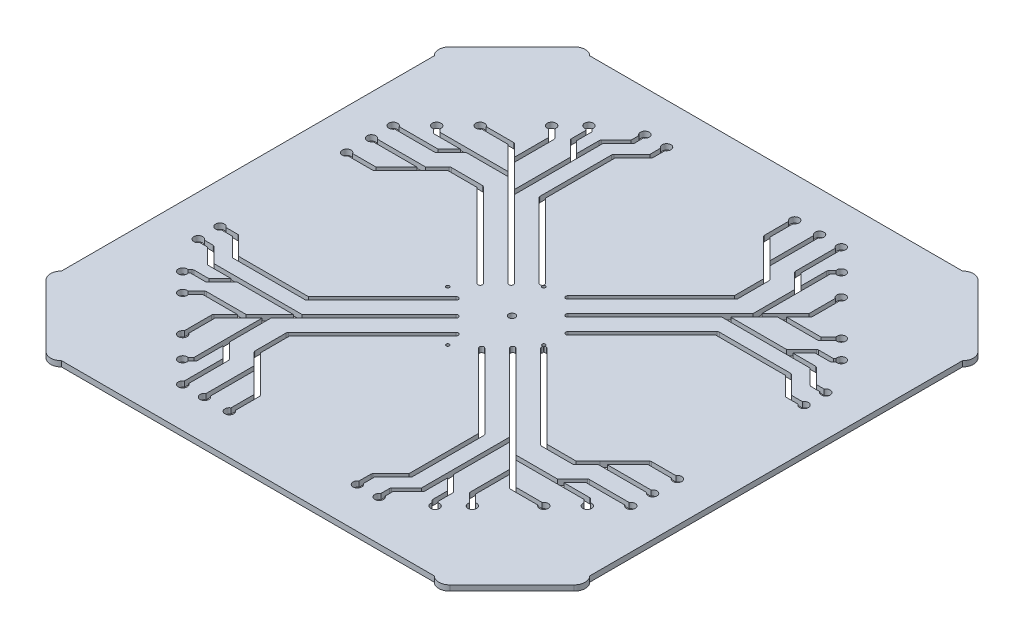
from build123d import *

# Parameters (mm, degrees)
BOSS_EXTRUDE1_OUTLINE_R   = 3.0005
BOSS_EXTRUDE1_DEPTH       = 5
F_3_0MM_DOWEL_HOLE1_D     = 3
F_3_0MM_DOWEL_HOLE1_DEPTH = 23
F_3_0MM_DOWEL_HOLE1_TIP   = 0.901290929


# Read off the part's stored shape, not the designer's step: Boss-Extrude1
with BuildPart() as part:
    # Boss-Extrude1 outline → Boss-Extrude1 (new body)
    with BuildSketch(Plane(origin=(0, 0, 0), x_dir=(1, 0, 0), z_dir=(0, 1, 0))):
        with BuildLine():
            ThreePointArc((-240.416840957, -169.705683688), (-243.345680368, -176.777104075), (-240.416663372, -183.848450908))
            ThreePointArc((-240.416663372, -183.848450908), (-240.416545273, -183.84763361), (-240.415777249, -183.847937028))
            Line((-240.415777249, -183.847937028), (-183.847440958, -240.41627332))
            ThreePointArc((-183.847440958, -240.41627332), (-176.776668104, -243.344933138), (-169.705934893, -240.416177611))
            ThreePointArc((-169.705934893, -240.416177611), (-169.705776232, -240.416065882), (-169.705584901, -240.416028356))
            Line((-169.705584901, -240.416028356), (169.705715099, -240.416028357))
            ThreePointArc((169.705715099, -240.416028357), (169.705904517, -240.41606656), (169.70606509, -240.416174054))
            ThreePointArc((169.70606509, -240.416174054), (176.776796895, -243.344832258), (183.847511548, -240.416127618))
            Line((183.847511548, -240.416127618), (240.41607294, -183.847689011))
            ThreePointArc((240.41607294, -183.847689011), (243.344946822, -176.777070236), (240.416493559, -169.706277241))
            ThreePointArc((240.416493559, -169.706277241), (240.416198695, -169.706232068), (240.415994505, -169.706014601))
            ThreePointArc((240.415994505, -169.706014601), (240.415625207, -169.705529599), (240.415954506, -169.705016598))
            Line((240.415954506, -169.705016598), (240.415960006, 169.705472419))
            ThreePointArc((240.415960006, 169.705472419), (240.415993998, 169.705647897), (240.416093049, 169.705796681))
            ThreePointArc((240.416093049, 169.705796681), (243.344777242, 176.776521251), (240.416088713, 183.847246292))
            Line((240.416088713, 183.847246292), (213.552385977, 210.712299185))
            Line((213.552385977, 210.712299185), (183.848254125, 240.41651169))
            ThreePointArc((183.848254125, 240.41651169), (176.77708352, 243.344924484), (169.706152209, 240.415933939))
            ThreePointArc((169.706152209, 240.415933939), (169.705982159, 240.415634754), (169.705659043, 240.415516325))
            Line((169.705659043, 240.415516325), (-169.705640957, 240.415516325))
            ThreePointArc((-169.705640957, 240.415516325), (-169.705953336, 240.415625916), (-169.706128779, 240.415906648))
            ThreePointArc((-169.706128779, 240.415906648), (-176.77682132, 243.344422742), (-183.847437503, 240.415722292))
            Line((-183.847437503, 240.415722292), (-240.415945248, 183.847114547))
            ThreePointArc((-240.415945248, 183.847114547), (-243.344629178, 176.776449895), (-240.415995236, 169.705764538))
            ThreePointArc((-240.415995236, 169.705764538), (-240.41588385, 169.705606698), (-240.415845984, 169.705416325))
            Line((-240.415845984, 169.705416325), (-240.415840957, -169.705883675))
            ThreePointArc((-240.415840957, -169.705883675), (-240.416340957, -169.706383675), (-240.416840957, -169.705683688))
        make_face()
        with BuildLine():
            Line((-88.746659877, -114.870657252), (-12.379109877, -38.503107252))
            ThreePointArc((-12.379109877, -38.503107252), (-9.550659876, -38.503107251), (-9.550659876, -41.331557252))
            Line((-9.550659876, -41.331557252), (-85.332453159, -117.113350535))
            Line((-85.332453159, -117.113350535), (-85.332453159, -143.740614765))
            Line((-85.332453159, -143.740614765), (-74.604410722, -154.46856238))
            Line((-74.604410722, -154.46856238), (-51.977042487, -177.096033675))
            ThreePointArc((-51.977042487, -177.096033675), (-51.543485814, -177.74489709), (-51.391240957, -178.510283675))
            Line((-51.391240957, -178.510283675), (-51.391240957, -200.50198206))
            ThreePointArc((-51.391240957, -200.50198206), (-53.391240957, -207.966083675), (-55.391240957, -200.50198206))
            Line((-55.391240957, -200.50198206), (-55.391240957, -179.338832538))
            Line((-55.391240957, -179.338832538), (-74.018740957, -160.711247695))
            Line((-74.018740957, -160.711247695), (-74.018740957, -200.50198206))
            ThreePointArc((-74.018740957, -200.50198206), (-76.018740957, -207.966083675), (-78.018740957, -200.50198206))
            Line((-78.018740957, -200.50198206), (-78.018740957, -156.711232303))
            Line((-78.018740957, -156.711232303), (-88.74666653, -145.983309632))
            ThreePointArc((-88.74666653, -145.983309632), (-89.180212173, -145.334462868), (-89.332453159, -144.569095878))
            Line((-89.332453159, -144.569095878), (-89.332453159, -116.291342276))
            ThreePointArc((-89.332453159, -116.291342276), (-89.181449298, -115.522492892), (-88.746659877, -114.870657252))
        make_face(mode=Mode.SUBTRACT)
        with BuildLine():
            Line((-107.959794229, -77.515273003), (-40.663366193, -10.218850935))
            ThreePointArc((-40.663366193, -10.218850935), (-37.834916193, -10.21885106), (-37.834916318, -13.047301061))
            Line((-37.834916318, -13.047301061), (-105.717194298, -80.929567004))
            ThreePointArc((-105.717194298, -80.929567004), (-106.373986935, -81.366384948), (-107.148593708, -81.515283676))
            Line((-107.148593708, -81.515283676), (-172.185240957, -81.515283676))
            ThreePointArc((-172.185240957, -81.515283676), (-172.950607738, -81.363042775), (-173.599454392, -80.929497366))
            Line((-173.599454392, -80.929497366), (-189.984281709, -64.544673003))
            Line((-189.984281709, -64.544673003), (-199.833828669, -64.544673003))
            ThreePointArc((-199.833828669, -64.544673003), (-207.297930284, -62.544673003), (-199.833828669, -60.544673003))
            Line((-199.833828669, -60.544673003), (-189.155730284, -60.544673003))
            ThreePointArc((-189.155730284, -60.544673003), (-188.390343699, -60.69691786), (-187.741480284, -61.130474533))
            Line((-187.741480284, -61.130474533), (-171.356778363, -77.515273003))
            Line((-171.356778363, -77.515273003), (-107.959794229, -77.515273003))
        make_face(mode=Mode.SUBTRACT)
        with BuildLine():
            Line((-96.646054519, -94.485870113), (-26.521234877, -24.361050471))
            ThreePointArc((-26.521234877, -24.361050471), (-23.692853096, -24.361050471), (-23.692853096, -27.189432252))
            Line((-23.692853096, -27.189432252), (-107.959865234, -111.456444391))
            Line((-107.959865234, -111.456444391), (-107.959865234, -149.397628131))
            Line((-107.959865234, -149.397628131), (-94.403495957, -162.953901551))
            ThreePointArc((-94.403495957, -162.953901551), (-93.969946807, -163.602749982), (-93.817704519, -164.368120113))
            Line((-93.817704519, -164.368120113), (-93.817704519, -200.502018498))
            ThreePointArc((-93.817704519, -200.502018498), (-95.817704519, -207.966120113), (-97.817704519, -200.502018498))
            Line((-97.817704519, -200.502018498), (-97.817704519, -165.196545437))
            Line((-97.817704519, -165.196545437), (-107.959865234, -155.054450658))
            Line((-107.959865234, -155.054450658), (-107.959865234, -178.510310674))
            ThreePointArc((-107.959865234, -178.510310674), (-108.113869082, -179.279919798), (-108.552163438, -179.931006156))
            Line((-108.552163438, -179.931006156), (-111.752943384, -183.131786102))
            ThreePointArc((-111.752943384, -183.131786102), (-118.445039213, -186.995539669), (-114.581422253, -180.30336497))
            Line((-114.581422253, -180.30336497), (-111.959840957, -177.681783674))
            Line((-111.959840957, -177.681783674), (-111.959840957, -115.456397087))
            Line((-111.959840957, -115.456397087), (-133.415640957, -136.912281374))
            Line((-133.415640957, -136.912281374), (-133.415640957, -160.90398206))
            ThreePointArc((-133.415640957, -160.90398206), (-135.415640957, -168.368083675), (-137.415640957, -160.90398206))
            Line((-137.415640957, -160.90398206), (-137.415640957, -136.083883676))
            ThreePointArc((-137.415640957, -136.083883676), (-137.263400022, -135.318516811), (-136.829854519, -134.669670113))
            Line((-136.829854519, -134.669670113), (-126.101904519, -123.941720113))
            Line((-126.101904519, -123.941720113), (-157.21460762, -123.941720113))
            Line((-157.21460762, -123.941720113), (-164.078807601, -130.805920094))
            ThreePointArc((-164.078807601, -130.805920094), (-170.770900984, -134.669677897), (-166.90728826, -127.977500753))
            Line((-166.90728826, -127.977500753), (-159.463134739, -120.533347231))
            ThreePointArc((-159.463134739, -120.533347231), (-158.812277528, -120.095542201), (-158.043104519, -119.941720113))
            Line((-158.043104519, -119.941720113), (-122.101904519, -119.941720113))
            Line((-122.101904519, -119.941720113), (-100.646054519, -98.485870113))
            Line((-100.646054519, -98.485870113), (-151.557760723, -98.485870113))
            Line((-151.557760723, -98.485870113), (-165.114107621, -112.042217011))
            ThreePointArc((-165.114107621, -112.042217011), (-165.782311764, -112.429011115), (-166.528301488, -112.628023144))
            Line((-166.528301488, -112.628023144), (-179.84208768, -112.628023144))
            Line((-179.84208768, -112.628023144), (-181.049394983, -113.835358904))
            ThreePointArc((-181.049394983, -113.835358904), (-187.741540813, -117.699038068), (-183.877803915, -111.006925571))
            Line((-183.877803915, -111.006925571), (-182.090895033, -109.220016689))
            ThreePointArc((-182.090895033, -109.220016689), (-181.439912656, -108.781944474), (-180.670501488, -108.628023144))
            Line((-180.670501488, -108.628023144), (-167.356703825, -108.628023144))
            Line((-167.356703825, -108.628023144), (-157.214704737, -98.485870113))
            Line((-157.214704737, -98.485870113), (-177.842057621, -98.485870113))
            ThreePointArc((-177.842057621, -98.485870113), (-178.607424486, -98.333629178), (-179.256271183, -97.900083675))
            Line((-179.256271183, -97.900083675), (-192.812652721, -84.343702138))
            Line((-192.812652721, -84.343702138), (-199.833751105, -84.343702138))
            ThreePointArc((-199.833751105, -84.343702138), (-207.297893572, -82.343824698), (-199.833802904, -80.343753938))
            Line((-199.833802904, -80.343753938), (-191.984204519, -80.343753938))
            ThreePointArc((-191.984204519, -80.343753938), (-191.218831464, -80.495996104), (-190.569979519, -80.929545113))
            Line((-190.569979519, -80.929545113), (-177.013654519, -94.485870113))
            Line((-177.013654519, -94.485870113), (-96.646054519, -94.485870113))
        make_face(mode=Mode.SUBTRACT)
        with BuildLine():
            Line((77.529248371, -107.944536948), (10.232826303, -40.648108911))
            ThreePointArc((10.232826303, -40.648108911), (10.232826429, -37.819658911), (13.061276429, -37.819659036))
            Line((13.061276429, -37.819659036), (80.943542372, -105.701937017))
            ThreePointArc((80.943542372, -105.701937017), (81.380360316, -106.358729654), (81.529259044, -107.133336427))
            Line((81.529259044, -107.133336427), (81.529259044, -172.169983676))
            ThreePointArc((81.529259044, -172.169983676), (81.377018143, -172.935350457), (80.943472733, -173.584197111))
            Line((80.943472733, -173.584197111), (64.558648371, -189.969024428))
            Line((64.558648371, -189.969024428), (64.558648371, -199.818571388))
            ThreePointArc((64.558648371, -199.818571388), (62.558648371, -207.282673003), (60.558648371, -199.818571388))
            Line((60.558648371, -199.818571388), (60.558648371, -189.140473003))
            ThreePointArc((60.558648371, -189.140473003), (60.710893228, -188.375086418), (61.144449901, -187.726223003))
            Line((61.144449901, -187.726223003), (77.529248371, -171.341521082))
            Line((77.529248371, -171.341521082), (77.529248371, -107.944536948))
        make_face(mode=Mode.SUBTRACT)
        with BuildLine():
            Line((94.499845481, -96.630797238), (24.375025839, -26.505977595))
            ThreePointArc((24.375025839, -26.505977595), (24.375025839, -23.677595814), (27.20340762, -23.677595814))
            Line((27.20340762, -23.677595814), (111.470419759, -107.944607953))
            Line((111.470419759, -107.944607953), (149.411603499, -107.944607953))
            Line((149.411603499, -107.944607953), (162.967876918, -94.388238675))
            ThreePointArc((162.967876918, -94.388238675), (163.61672535, -93.954689526), (164.382095481, -93.802447238))
            Line((164.382095481, -93.802447238), (200.515993866, -93.802447238))
            ThreePointArc((200.515993866, -93.802447238), (207.980095481, -95.802447238), (200.515993866, -97.802447238))
            Line((200.515993866, -97.802447238), (165.210520805, -97.802447238))
            Line((165.210520805, -97.802447238), (155.068426025, -107.944607953))
            Line((155.068426025, -107.944607953), (178.524286042, -107.944607953))
            ThreePointArc((178.524286042, -107.944607953), (179.293895159, -108.098611797), (179.944981513, -108.536906145))
            Line((179.944981513, -108.536906145), (183.14576147, -111.737686103))
            ThreePointArc((183.14576147, -111.737686103), (187.009515035, -118.429781933), (180.317340338, -114.566164971))
            Line((180.317340338, -114.566164971), (177.695759042, -111.944583676))
            Line((177.695759042, -111.944583676), (115.470372455, -111.944583676))
            Line((115.470372455, -111.944583676), (136.926256742, -133.400383676))
            Line((136.926256742, -133.400383676), (160.917957428, -133.400383676))
            ThreePointArc((160.917957428, -133.400383676), (168.382059043, -135.400383675), (160.917957428, -137.400383675))
            Line((160.917957428, -137.400383675), (136.097859044, -137.400383675))
            ThreePointArc((136.097859044, -137.400383675), (135.332492179, -137.24814274), (134.683645481, -136.814597237))
            Line((134.683645481, -136.814597237), (123.955695481, -126.086647238))
            Line((123.955695481, -126.086647238), (123.955695481, -157.199350339))
            Line((123.955695481, -157.199350339), (130.819895462, -164.06355032))
            ThreePointArc((130.819895462, -164.06355032), (134.683653264, -170.755643704), (127.99147612, -166.892030979))
            Line((127.99147612, -166.892030979), (120.547322613, -159.447877471))
            ThreePointArc((120.547322613, -159.447877471), (120.109517573, -158.797020256), (119.955695481, -158.027847238))
            Line((119.955695481, -158.027847238), (119.955695481, -122.086647238))
            Line((119.955695481, -122.086647238), (98.499845481, -100.630797238))
            Line((98.499845481, -100.630797238), (98.499845481, -151.542503442))
            Line((98.499845481, -151.542503442), (112.056192379, -165.09885034))
            ThreePointArc((112.056192379, -165.09885034), (112.442986483, -165.767054483), (112.641998512, -166.513044207))
            Line((112.641998512, -166.513044207), (112.641998512, -179.826830399))
            Line((112.641998512, -179.826830399), (113.849334272, -181.034137702))
            ThreePointArc((113.849334272, -181.034137702), (117.713013436, -187.726283532), (111.020900939, -183.862546634))
            Line((111.020900939, -183.862546634), (109.233992057, -182.075637751))
            ThreePointArc((109.233992057, -182.075637751), (108.795919842, -181.424655374), (108.641998512, -180.655244207))
            Line((108.641998512, -180.655244207), (108.641998512, -167.341446544))
            Line((108.641998512, -167.341446544), (98.499845481, -157.199447455))
            Line((98.499845481, -157.199447455), (98.499845481, -177.82680034))
            ThreePointArc((98.499845481, -177.82680034), (98.347604546, -178.592167205), (97.914059043, -179.241013902))
            Line((97.914059043, -179.241013902), (84.357677506, -192.797395439))
            Line((84.357677506, -192.797395439), (84.357677506, -199.818493823))
            ThreePointArc((84.357677506, -199.818493823), (82.357800068, -207.282636291), (80.357729306, -199.818545623))
            Line((80.357729306, -199.818545623), (80.357729306, -191.968947238))
            ThreePointArc((80.357729306, -191.968947238), (80.509971472, -191.203574183), (80.943520481, -190.554722238))
            Line((80.943520481, -190.554722238), (94.499845481, -176.998397238))
            Line((94.499845481, -176.998397238), (94.499845481, -96.630797238))
        make_face(mode=Mode.SUBTRACT)
        with Locations((-4.0957e-05, -0.000283675)):
            Circle(BOSS_EXTRUDE1_OUTLINE_R, mode=Mode.SUBTRACT)
        with BuildLine():
            Line((114.88463262, -88.731402595), (38.51708262, -12.363852595))
            ThreePointArc((38.51708262, -12.363852595), (38.51708262, -9.535402595), (41.34553262, -9.535402595))
            Line((41.34553262, -9.535402595), (117.127325903, -85.317195878))
            Line((117.127325903, -85.317195878), (143.754590133, -85.317195878))
            Line((143.754590133, -85.317195878), (154.482537748, -74.589153441))
            Line((154.482537748, -74.589153441), (177.110009043, -51.961785206))
            ThreePointArc((177.110009043, -51.961785206), (177.758872459, -51.528228533), (178.524259043, -51.375983675))
            Line((178.524259043, -51.375983675), (200.515957428, -51.375983675))
            ThreePointArc((200.515957428, -51.375983675), (207.980059043, -53.375983675), (200.515957428, -55.375983675))
            Line((200.515957428, -55.375983675), (179.352807906, -55.375983675))
            Line((179.352807906, -55.375983675), (160.725223063, -74.003483675))
            Line((160.725223063, -74.003483675), (200.515957428, -74.003483675))
            ThreePointArc((200.515957428, -74.003483675), (207.980059043, -76.003483675), (200.515957428, -78.003483675))
            Line((200.515957428, -78.003483675), (156.725207671, -78.003483675))
            Line((156.725207671, -78.003483675), (145.997285, -88.731409249))
            ThreePointArc((145.997285, -88.731409249), (145.348438236, -89.164954891), (144.583071246, -89.317195878))
            Line((144.583071246, -89.317195878), (116.305317645, -89.317195878))
            ThreePointArc((116.305317645, -89.317195878), (115.53646826, -89.166192017), (114.88463262, -88.731402595))
        make_face(mode=Mode.SUBTRACT)
        with BuildLine():
            Line((-114.885914533, 88.760635244), (-38.518364533, 12.393085244))
            ThreePointArc((-38.518364533, 12.393085244), (-38.518364534, 9.564635243), (-41.346814534, 9.564635244))
            Line((-41.346814534, 9.564635244), (-117.128607817, 85.346428527))
            Line((-117.128607817, 85.346428527), (-143.755872047, 85.346428527))
            Line((-143.755872047, 85.346428527), (-154.483819661, 74.61838609))
            Line((-154.483819661, 74.61838609), (-177.111290957, 51.991017855))
            ThreePointArc((-177.111290957, 51.991017855), (-177.760154372, 51.557461182), (-178.525540957, 51.405216325))
            Line((-178.525540957, 51.405216325), (-200.517239342, 51.405216325))
            ThreePointArc((-200.517239342, 51.405216325), (-207.981340957, 53.405216325), (-200.517239342, 55.405216325))
            Line((-200.517239342, 55.405216325), (-179.35408982, 55.405216325))
            Line((-179.35408982, 55.405216325), (-160.726504976, 74.032716325))
            Line((-160.726504976, 74.032716325), (-200.517239342, 74.032716325))
            ThreePointArc((-200.517239342, 74.032716325), (-207.981340957, 76.032716325), (-200.517239342, 78.032716325))
            Line((-200.517239342, 78.032716325), (-156.726489584, 78.032716325))
            Line((-156.726489584, 78.032716325), (-145.998566913, 88.760641898))
            ThreePointArc((-145.998566913, 88.760641898), (-145.349720149, 89.19418754), (-144.584353159, 89.346428527))
            Line((-144.584353159, 89.346428527), (-116.306599558, 89.346428527))
            ThreePointArc((-116.306599558, 89.346428527), (-115.537750173, 89.195424666), (-114.885914533, 88.760635244))
        make_face(mode=Mode.SUBTRACT)
        with BuildLine():
            Line((-94.501127394, 96.660029887), (-24.376307752, 26.535210245))
            ThreePointArc((-24.376307752, 26.535210245), (-24.376307752, 23.706828464), (-27.204689533, 23.706828464))
            Line((-27.204689533, 23.706828464), (-111.471701672, 107.973840603))
            Line((-111.471701672, 107.973840603), (-149.412885412, 107.973840603))
            Line((-149.412885412, 107.973840603), (-162.969158832, 94.417471325))
            ThreePointArc((-162.969158832, 94.417471325), (-163.618007263, 93.983922175), (-164.383377394, 93.831679887))
            Line((-164.383377394, 93.831679887), (-200.517275779, 93.831679887))
            ThreePointArc((-200.517275779, 93.831679887), (-207.981377394, 95.831679887), (-200.517275779, 97.831679887))
            Line((-200.517275779, 97.831679887), (-165.211802718, 97.831679887))
            Line((-165.211802718, 97.831679887), (-155.069707939, 107.973840603))
            Line((-155.069707939, 107.973840603), (-178.525567955, 107.973840603))
            ThreePointArc((-178.525567955, 107.973840603), (-179.295177052, 108.127844438), (-179.946263396, 108.566138765))
            Line((-179.946263396, 108.566138765), (-183.147043384, 111.766918752))
            ThreePointArc((-183.147043384, 111.766918752), (-187.010796948, 118.459014583), (-180.318622251, 114.59539762))
            Line((-180.318622251, 114.59539762), (-177.697040956, 111.973816325))
            Line((-177.697040956, 111.973816325), (-115.471654369, 111.973816325))
            Line((-115.471654369, 111.973816325), (-136.927538655, 133.429616325))
            Line((-136.927538655, 133.429616325), (-160.919239341, 133.429616325))
            ThreePointArc((-160.919239341, 133.429616325), (-168.383340957, 135.429616323), (-160.919239342, 137.429616325))
            Line((-160.919239342, 137.429616325), (-136.099140957, 137.429616325))
            ThreePointArc((-136.099140957, 137.429616325), (-135.333774092, 137.27737539), (-134.684927394, 136.843829887))
            Line((-134.684927394, 136.843829887), (-123.956977394, 126.115879887))
            Line((-123.956977394, 126.115879887), (-123.956977394, 157.228582988))
            Line((-123.956977394, 157.228582988), (-130.821177376, 164.092782969))
            ThreePointArc((-130.821177376, 164.092782969), (-134.684935177, 170.784876353), (-127.992758034, 166.921263628))
            Line((-127.992758034, 166.921263628), (-120.548604488, 159.477110082))
            ThreePointArc((-120.548604488, 159.477110082), (-120.110799476, 158.82625288), (-119.956977394, 158.057079887))
            Line((-119.956977394, 158.057079887), (-119.956977394, 122.115879887))
            Line((-119.956977394, 122.115879887), (-98.501127394, 100.660029887))
            Line((-98.501127394, 100.660029887), (-98.501127394, 151.571736091))
            Line((-98.501127394, 151.571736091), (-112.057474292, 165.128082989))
            ThreePointArc((-112.057474292, 165.128082989), (-112.444268396, 165.796287132), (-112.643280426, 166.542276856))
            Line((-112.643280426, 166.542276856), (-112.643280426, 179.856063048))
            Line((-112.643280426, 179.856063048), (-113.850616185, 181.063370351))
            ThreePointArc((-113.850616185, 181.063370351), (-117.714295351, 187.75551618), (-111.022182853, 183.891779283))
            Line((-111.022182853, 183.891779283), (-109.23527397, 182.104870401))
            ThreePointArc((-109.23527397, 182.104870401), (-108.797201756, 181.453888023), (-108.643280426, 180.684476856))
            Line((-108.643280426, 180.684476856), (-108.643280426, 167.370679193))
            Line((-108.643280426, 167.370679193), (-98.501127394, 157.228680105))
            Line((-98.501127394, 157.228680105), (-98.501127394, 177.856032989))
            ThreePointArc((-98.501127394, 177.856032989), (-98.348886459, 178.621399853), (-97.915340957, 179.270246551))
            Line((-97.915340957, 179.270246551), (-84.358959419, 192.826628089))
            Line((-84.358959419, 192.826628089), (-84.358959419, 199.847726473))
            ThreePointArc((-84.358959419, 199.847726473), (-82.359081979, 207.31186894), (-80.359011219, 199.847778272))
            Line((-80.359011219, 199.847778272), (-80.359011219, 191.998179887))
            ThreePointArc((-80.359011219, 191.998179887), (-80.511253385, 191.232806832), (-80.944802394, 190.583954887))
            Line((-80.944802394, 190.583954887), (-94.501127394, 177.027629887))
            Line((-94.501127394, 177.027629887), (-94.501127394, 96.660029887))
        make_face(mode=Mode.SUBTRACT)
        with BuildLine():
            Line((-77.530530284, 107.973769597), (-10.234108217, 40.677341561))
            ThreePointArc((-10.234108217, 40.677341561), (-10.234108342, 37.84889156), (-13.062558343, 37.848891686))
            Line((-13.062558343, 37.848891686), (-80.944824285, 105.731169666))
            ThreePointArc((-80.944824285, 105.731169666), (-81.381642229, 106.387962303), (-81.530540957, 107.162569077))
            Line((-81.530540957, 107.162569077), (-81.530540957, 172.199216325))
            ThreePointArc((-81.530540957, 172.199216325), (-81.378300057, 172.964583107), (-80.944754647, 173.61342976))
            Line((-80.944754647, 173.61342976), (-64.559930285, 189.998257077))
            Line((-64.559930285, 189.998257077), (-64.559930285, 199.847804037))
            ThreePointArc((-64.559930285, 199.847804037), (-62.559930284, 207.311905652), (-60.559930284, 199.847804037))
            Line((-60.559930284, 199.847804037), (-60.559930284, 189.169705652))
            ThreePointArc((-60.559930284, 189.169705652), (-60.712175142, 188.404319067), (-61.145731815, 187.755455652))
            Line((-61.145731815, 187.755455652), (-77.530530284, 171.370753731))
            Line((-77.530530284, 171.370753731), (-77.530530284, 107.973769597))
        make_face(mode=Mode.SUBTRACT)
        with BuildLine():
            Line((96.644772606, 94.515102762), (26.519952963, 24.39028312))
            ThreePointArc((26.519952963, 24.39028312), (23.691571182, 24.39028312), (23.691571182, 27.218664901))
            Line((23.691571182, 27.218664901), (107.958583321, 111.48567704))
            Line((107.958583321, 111.48567704), (107.958583321, 149.42686078))
            Line((107.958583321, 149.42686078), (94.402214043, 162.9831342))
            ThreePointArc((94.402214043, 162.9831342), (93.968664894, 163.631982631), (93.816422606, 164.397352762))
            Line((93.816422606, 164.397352762), (93.816422606, 200.531251147))
            ThreePointArc((93.816422606, 200.531251147), (95.816422606, 207.995352762), (97.816422606, 200.531251147))
            Line((97.816422606, 200.531251147), (97.816422606, 165.225778086))
            Line((97.816422606, 165.225778086), (107.958583321, 155.083683307))
            Line((107.958583321, 155.083683307), (107.958583321, 178.539543324))
            ThreePointArc((107.958583321, 178.539543324), (108.112587165, 179.30915244), (108.550881513, 179.960238794))
            Line((108.550881513, 179.960238794), (111.75166147, 183.161018752))
            ThreePointArc((111.75166147, 183.161018752), (118.4437573, 187.024772317), (114.580140339, 180.332597619))
            Line((114.580140339, 180.332597619), (111.958559043, 177.711016324))
            Line((111.958559043, 177.711016324), (111.958559043, 115.485629737))
            Line((111.958559043, 115.485629737), (133.414359043, 136.941514023))
            Line((133.414359043, 136.941514023), (133.414359043, 160.933214709))
            ThreePointArc((133.414359043, 160.933214709), (135.414359041, 168.397316325), (137.414359043, 160.93321471))
            Line((137.414359043, 160.93321471), (137.414359043, 136.113116325))
            ThreePointArc((137.414359043, 136.113116325), (137.262118108, 135.34774946), (136.828572605, 134.698902762))
            Line((136.828572605, 134.698902762), (126.100622605, 123.970952762))
            Line((126.100622605, 123.970952762), (157.213325707, 123.970952762))
            Line((157.213325707, 123.970952762), (164.077525688, 130.835152744))
            ThreePointArc((164.077525688, 130.835152744), (170.769619072, 134.698910545), (166.906006347, 128.006733402))
            Line((166.906006347, 128.006733402), (159.461852839, 120.562579893))
            ThreePointArc((159.461852839, 120.562579893), (158.810995624, 120.124774854), (158.041822606, 119.970952762))
            Line((158.041822606, 119.970952762), (122.100622606, 119.970952762))
            Line((122.100622606, 119.970952762), (100.644772606, 98.515102762))
            Line((100.644772606, 98.515102762), (151.55647881, 98.515102762))
            Line((151.55647881, 98.515102762), (165.112825708, 112.07144966))
            ThreePointArc((165.112825708, 112.07144966), (165.781029851, 112.458243764), (166.527019574, 112.657255793))
            Line((166.527019574, 112.657255793), (179.840805767, 112.657255793))
            Line((179.840805767, 112.657255793), (181.04811307, 113.864591553))
            ThreePointArc((181.04811307, 113.864591553), (187.740258901, 117.728270717), (183.876522001, 111.03615822))
            Line((183.876522001, 111.03615822), (182.08961312, 109.249249339))
            ThreePointArc((182.08961312, 109.249249339), (181.438630742, 108.811177124), (180.669219574, 108.657255793))
            Line((180.669219574, 108.657255793), (167.355421912, 108.657255793))
            Line((167.355421912, 108.657255793), (157.213422823, 98.515102762))
            Line((157.213422823, 98.515102762), (177.840775708, 98.515102762))
            ThreePointArc((177.840775708, 98.515102762), (178.606142572, 98.362861827), (179.25498927, 97.929316325))
            Line((179.25498927, 97.929316325), (192.811370807, 84.372934787))
            Line((192.811370807, 84.372934787), (199.832469191, 84.372934787))
            ThreePointArc((199.832469191, 84.372934787), (207.296611658, 82.373057349), (199.832520991, 80.372986587))
            Line((199.832520991, 80.372986587), (191.982922606, 80.372986587))
            ThreePointArc((191.982922606, 80.372986587), (191.217549551, 80.525228753), (190.568697606, 80.958777762))
            Line((190.568697606, 80.958777762), (177.012372606, 94.515102762))
            Line((177.012372606, 94.515102762), (96.644772606, 94.515102762))
        make_face(mode=Mode.SUBTRACT)
        with BuildLine():
            Line((107.958512316, 77.544505652), (40.662084279, 10.248083585))
            ThreePointArc((40.662084279, 10.248083585), (37.833634278, 10.248083711), (37.833634404, 13.076533711))
            Line((37.833634404, 13.076533711), (105.715912385, 80.958799653))
            ThreePointArc((105.715912385, 80.958799653), (106.372705022, 81.395617597), (107.147311795, 81.544516325))
            Line((107.147311795, 81.544516325), (172.183959044, 81.544516325))
            ThreePointArc((172.183959044, 81.544516325), (172.949325825, 81.392275424), (173.598172478, 80.958730015))
            Line((173.598172478, 80.958730015), (189.982999796, 64.573905652))
            Line((189.982999796, 64.573905652), (199.832546756, 64.573905652))
            ThreePointArc((199.832546756, 64.573905652), (207.296648371, 62.573905652), (199.832546756, 60.573905652))
            Line((199.832546756, 60.573905652), (189.154448371, 60.573905652))
            ThreePointArc((189.154448371, 60.573905652), (188.389061786, 60.72615051), (187.740198371, 61.159707183))
            Line((187.740198371, 61.159707183), (171.355496449, 77.544505652))
            Line((171.355496449, 77.544505652), (107.958512316, 77.544505652))
        make_face(mode=Mode.SUBTRACT)
        with BuildLine():
            Line((88.745377963, 114.899889901), (12.377827963, 38.532339901))
            ThreePointArc((12.377827963, 38.532339901), (9.549377963, 38.532339901), (9.549377963, 41.360789901))
            Line((9.549377963, 41.360789901), (85.331171246, 117.142583185))
            Line((85.331171246, 117.142583185), (85.331171246, 143.769847415))
            Line((85.331171246, 143.769847415), (74.603128809, 154.497795029))
            Line((74.603128809, 154.497795029), (51.975760574, 177.125266325))
            ThreePointArc((51.975760574, 177.125266325), (51.542203901, 177.77412974), (51.389959043, 178.539516325))
            Line((51.389959043, 178.539516325), (51.389959043, 200.531214709))
            ThreePointArc((51.389959043, 200.531214709), (53.389959043, 207.995316325), (55.389959043, 200.531214709))
            Line((55.389959043, 200.531214709), (55.389959043, 179.368065187))
            Line((55.389959043, 179.368065187), (74.017459043, 160.740480344))
            Line((74.017459043, 160.740480344), (74.017459043, 200.531214709))
            ThreePointArc((74.017459043, 200.531214709), (76.017459043, 207.995316325), (78.017459043, 200.531214709))
            Line((78.017459043, 200.531214709), (78.017459043, 156.740464952))
            Line((78.017459043, 156.740464952), (88.745384617, 146.012542281))
            ThreePointArc((88.745384617, 146.012542281), (89.178930259, 145.363695517), (89.331171246, 144.598328527))
            Line((89.331171246, 144.598328527), (89.331171246, 116.320574926))
            ThreePointArc((89.331171246, 116.320574926), (89.180167385, 115.551725541), (88.745377963, 114.899889901))
        make_face(mode=Mode.SUBTRACT)
    extrude(amount=BOSS_EXTRUDE1_DEPTH)

    # Ø3.0mm Dowel Hole1
    with Locations(Plane(origin=(0, 5, 0), x_dir=(1, 0, 0), z_dir=(0, 1, 0))):
        with Locations((-8.533913928, 37.426772924), (-52.242764878, -6.282078026), (-6.2808241, -52.244018803), (37.428026849, -8.535167853)):
            Hole(F_3_0MM_DOWEL_HOLE1_D / 2, depth=F_3_0MM_DOWEL_HOLE1_DEPTH)
            with Locations((0, 0, -(F_3_0MM_DOWEL_HOLE1_DEPTH + F_3_0MM_DOWEL_HOLE1_TIP / 2))):  # 118° drill point
                Cone(0, F_3_0MM_DOWEL_HOLE1_D / 2, F_3_0MM_DOWEL_HOLE1_TIP, mode=Mode.SUBTRACT)


solid = part.part
